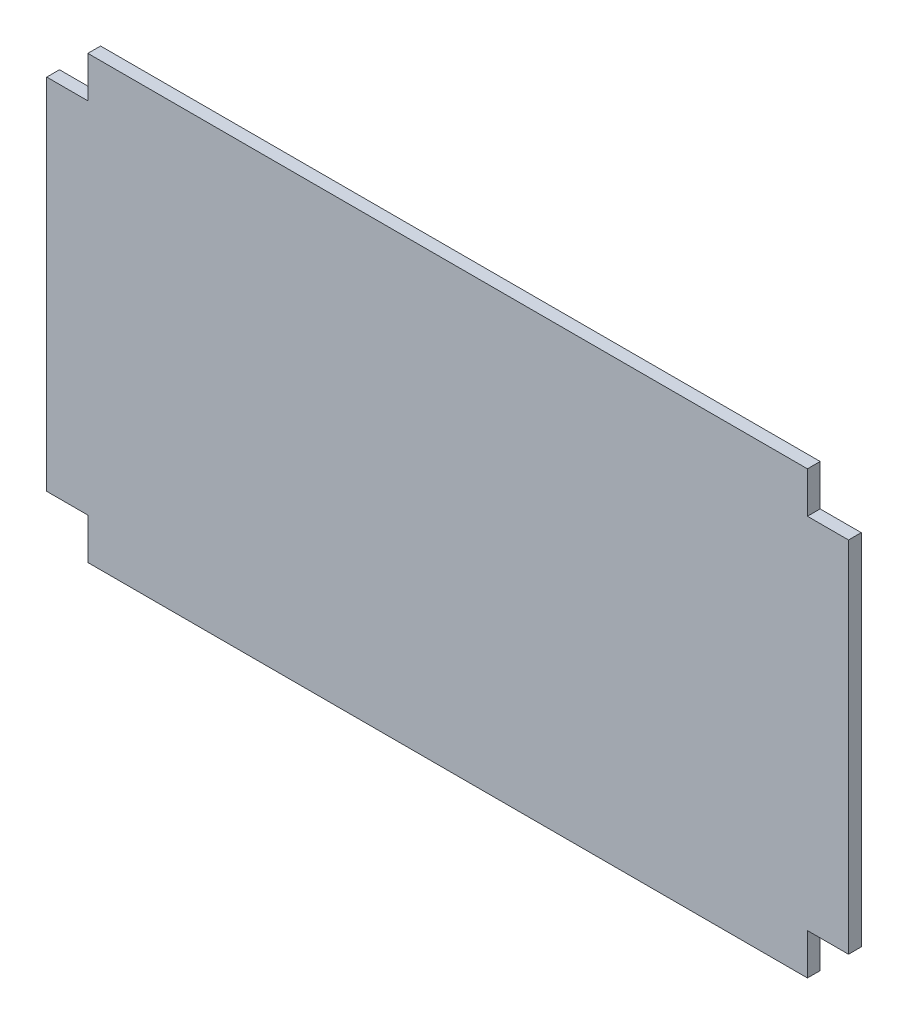
from build123d import *

# Parameters (mm, degrees)
SKETCH2_W           = 800
SKETCH2_H           = 440
BOSS_EXTRUDE1_DEPTH = 12.7
CUT_EXTRUDE1_REACH  = 458.685
SKETCH3_W           = 41
SKETCH3_H           = 41


with BuildPart() as part:
    # Sketch2 → Boss-Extrude1 (new body)
    with BuildSketch(Plane.XY):
        Rectangle(SKETCH2_W, SKETCH2_H)
    extrude(amount=BOSS_EXTRUDE1_DEPTH)

    # Sketch3 → Cut-Extrude1 (cut, up to next)
    with BuildSketch(Plane.XY.offset(12.7), mode=Mode.PRIVATE) as cut_extrude1_sk1:
        with Locations((-379.5, 199.5)):
            Rectangle(SKETCH3_W, SKETCH3_H)
    cut_extrude1_tool1 = extrude(cut_extrude1_sk1.sketch, amount=-CUT_EXTRUDE1_REACH, mode=Mode.PRIVATE) & part.part
    # Sketch3 → Cut-Extrude1 (cut, up to next)
    with BuildSketch(Plane.XY.offset(12.7), mode=Mode.PRIVATE) as cut_extrude1_sk2:
        with Locations((379.5, 199.5)):
            Rectangle(SKETCH3_W, SKETCH3_H)
    cut_extrude1_tool2 = extrude(cut_extrude1_sk2.sketch, amount=-CUT_EXTRUDE1_REACH, mode=Mode.PRIVATE) & part.part
    # Sketch3 → Cut-Extrude1 (cut, up to next)
    with BuildSketch(Plane.XY.offset(12.7), mode=Mode.PRIVATE) as cut_extrude1_sk3:
        with Locations((379.5, -199.5)):
            Rectangle(SKETCH3_W, SKETCH3_H)
    cut_extrude1_tool3 = extrude(cut_extrude1_sk3.sketch, amount=-CUT_EXTRUDE1_REACH, mode=Mode.PRIVATE) & part.part
    # Sketch3 → Cut-Extrude1 (cut, up to next)
    with BuildSketch(Plane.XY.offset(12.7), mode=Mode.PRIVATE) as cut_extrude1_sk4:
        with Locations((-379.5, -199.5)):
            Rectangle(SKETCH3_W, SKETCH3_H)
    cut_extrude1_tool4 = extrude(cut_extrude1_sk4.sketch, amount=-CUT_EXTRUDE1_REACH, mode=Mode.PRIVATE) & part.part
    add(cut_extrude1_tool1.solids().sort_by_distance((-379.5, 199.5, 12.7))[0], mode=Mode.SUBTRACT)
    add(cut_extrude1_tool2.solids().sort_by_distance((379.5, 199.5, 12.7))[0], mode=Mode.SUBTRACT)
    add(cut_extrude1_tool3.solids().sort_by_distance((379.5, -199.5, 12.7))[0], mode=Mode.SUBTRACT)
    add(cut_extrude1_tool4.solids().sort_by_distance((-379.5, -199.5, 12.7))[0], mode=Mode.SUBTRACT)


solid = part.part
